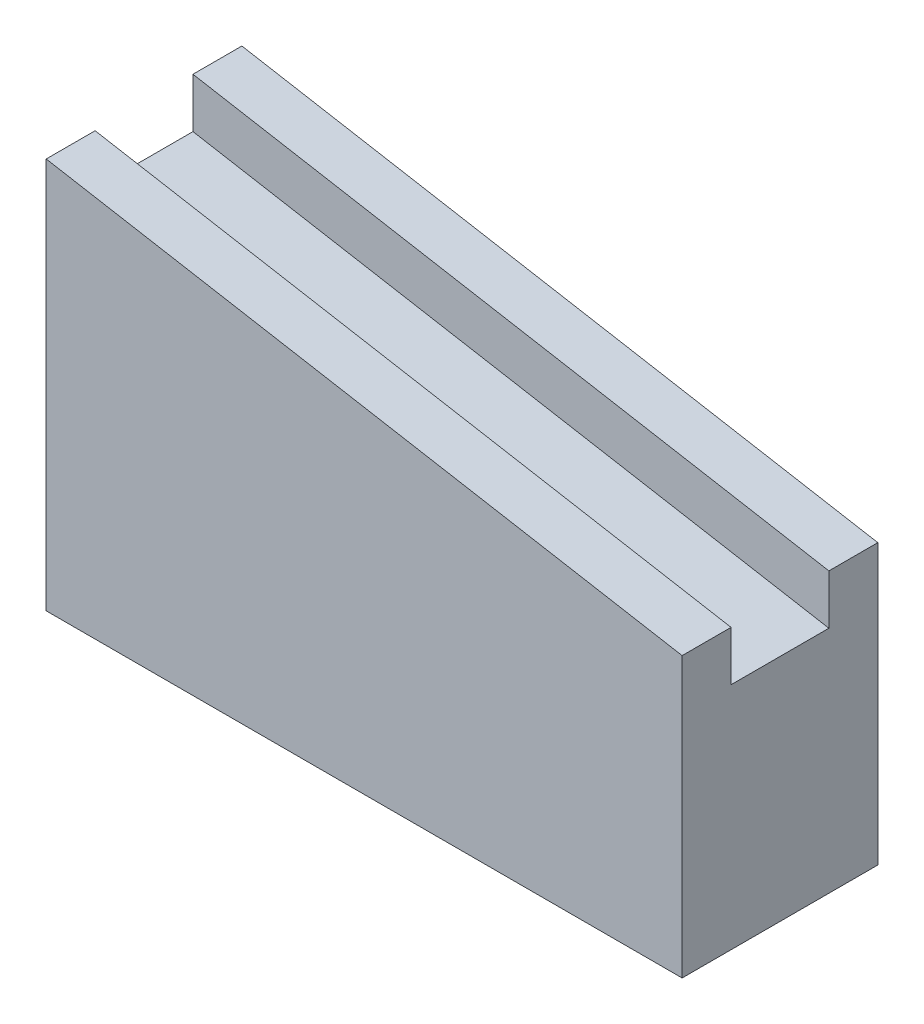
from build123d import *

# Parameters (mm, degrees)
RESSALTO_EXTRUS_O1_DEPTH = 40
ESBO_O4_W                = 171.630568717
ESBO_O4_H                = 20
CORTE_EXTRUS_O3_DEPTH    = 10


with BuildPart() as part:
    # Esboço1 → Ressalto-extrusão1 (new body)
    with BuildSketch(Plane.XY):
        Polygon((-53.29532416, 9.300830565), (76.70467584, 9.300830565), (76.70467584, 66.378323073), (-53.29532416, 89.300830565), align=None)
    extrude(amount=RESSALTO_EXTRUS_O1_DEPTH)

    # Esboço4 → Corte-extrusão3 (cut)
    with BuildSketch(Plane(origin=(13.664290772, 77.494043834, 0), x_dir=(0.9848077530122075, -0.17364817766693377, 0), z_dir=(0.1736481776669338, 0.9848077530122076, 0))):
        with Locations((8.431345703, -20)):
            Rectangle(ESBO_O4_W, ESBO_O4_H)
    extrude(amount=-CORTE_EXTRUS_O3_DEPTH, mode=Mode.SUBTRACT)


solid = part.part
